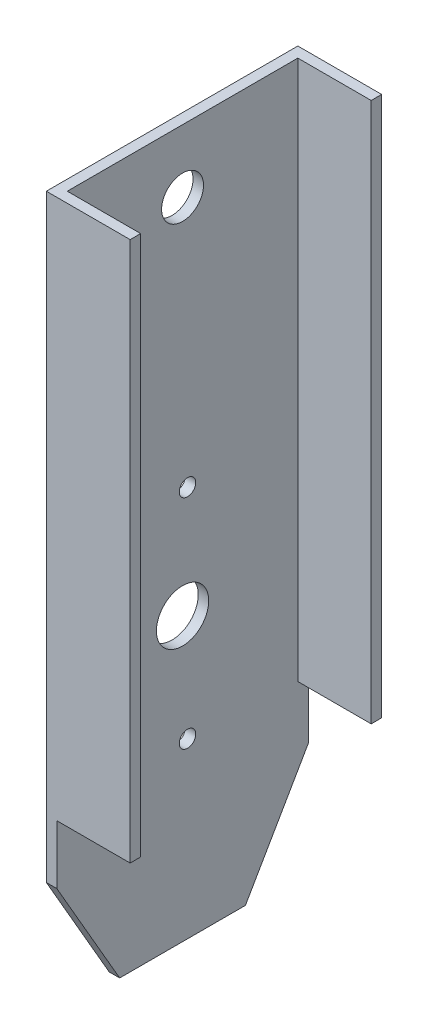
from build123d import *

# Parameters (mm, degrees)
BOSS_EXTRUDE1_DEPTH = 107.188
SKETCH2_W           = 22.225
SKETCH2_H           = 50.8
CUT_EXTRUDE1_DEPTH  = 208.026
SKETCH3_R           = 6.35
CUT_EXTRUDE2_DEPTH  = 45.974
CHAMFER1_SIZE       = 19.05
CHAMFER1_SIZE2      = 32.995567884
CHAMFER2_SIZE       = 19.05
CHAMFER2_SIZE2      = 32.995567884
CUT_EXTRUDE3_REACH  = 118.559
SKETCH4_R           = 2.499999953
SKETCH4_R_2         = 7.9248


with BuildPart() as part:
    # Sketch1 → Boss-Extrude1 (new, symmetric)
    with BuildSketch(Plane(origin=(0, 0, 0), x_dir=(1, 0, 0), z_dir=(0, 1, 0))):
        Polygon((-20.955, 0), (-20.955, 38.1), (4.445, 38.1), (4.445, 34.925), (-17.78, 34.925), (-17.78, -34.925), (4.445, -34.925), (4.445, -38.1), (-20.955, -38.1), align=None)
    extrude(amount=BOSS_EXTRUDE1_DEPTH, both=True)

    # Sketch2 → Cut-Extrude1 (cut)
    with BuildSketch(Plane.XY.offset(38.1)):
        with Locations((-6.6675, -81.788)):
            Rectangle(SKETCH2_W, SKETCH2_H)
    extrude(amount=-CUT_EXTRUDE1_DEPTH, mode=Mode.SUBTRACT)

    # Sketch3 → Cut-Extrude2 (cut)
    with BuildSketch(Plane.ZY.offset(20.955)):
        with Locations((0, 88.138)):
            Circle(SKETCH3_R)
    extrude(amount=-CUT_EXTRUDE2_DEPTH, mode=Mode.SUBTRACT)

    # Chamfer1
    chamfer1_edges = [part.edges().sort_by_distance(p)[0] for p in [
        (-19.3675, -107.188, -38.1),
    ]]
    chamfer1_side = [part.faces().sort_by_distance(p)[0] for p in [
        (-19.3675, -107.188, 0),
    ]]
    chamfer(chamfer1_edges, length=CHAMFER1_SIZE, length2=CHAMFER1_SIZE2, reference=chamfer1_side[0])

    # Chamfer2
    chamfer2_edges = [part.edges().sort_by_distance(p)[0] for p in [
        (-19.3675, -107.188, 38.1),
    ]]
    chamfer2_side = [part.faces().sort_by_distance(p)[0] for p in [
        (-19.3675, -107.188, 9.525),
    ]]
    chamfer(chamfer2_edges, length=CHAMFER2_SIZE, length2=CHAMFER2_SIZE2, reference=chamfer2_side[0])

    # Sketch4 → Cut-Extrude3 (cut, up to next)
    with BuildSketch(Plane.ZY.offset(20.955), mode=Mode.PRIVATE) as cut_extrude3_sk1:
        with Locations((-1.500000048, 11.312372418)):
            Circle(SKETCH4_R)
    cut_extrude3_tool1 = extrude(cut_extrude3_sk1.sketch, amount=-CUT_EXTRUDE3_REACH, mode=Mode.PRIVATE) & part.part
    # Sketch4 → Cut-Extrude3 (cut, up to next)
    with BuildSketch(Plane.ZY.offset(20.955), mode=Mode.PRIVATE) as cut_extrude3_sk2:
        with Locations((-1.500000048, -54.687627662)):
            Circle(SKETCH4_R)
    cut_extrude3_tool2 = extrude(cut_extrude3_sk2.sketch, amount=-CUT_EXTRUDE3_REACH, mode=Mode.PRIVATE) & part.part
    # Sketch4 → Cut-Extrude3 (cut, up to next)
    with BuildSketch(Plane.ZY.offset(20.955), mode=Mode.PRIVATE) as cut_extrude3_sk3:
        with Locations((0, -21.687627622)):
            Circle(SKETCH4_R_2)
    cut_extrude3_tool3 = extrude(cut_extrude3_sk3.sketch, amount=-CUT_EXTRUDE3_REACH, mode=Mode.PRIVATE) & part.part
    add(cut_extrude3_tool1.solids().sort_by_distance((-20.955, 11.312372, -1.5))[0], mode=Mode.SUBTRACT)
    add(cut_extrude3_tool2.solids().sort_by_distance((-20.955, -54.687628, -1.5))[0], mode=Mode.SUBTRACT)
    add(cut_extrude3_tool3.solids().sort_by_distance((-20.955, -21.687628, 0))[0], mode=Mode.SUBTRACT)


solid = part.part
